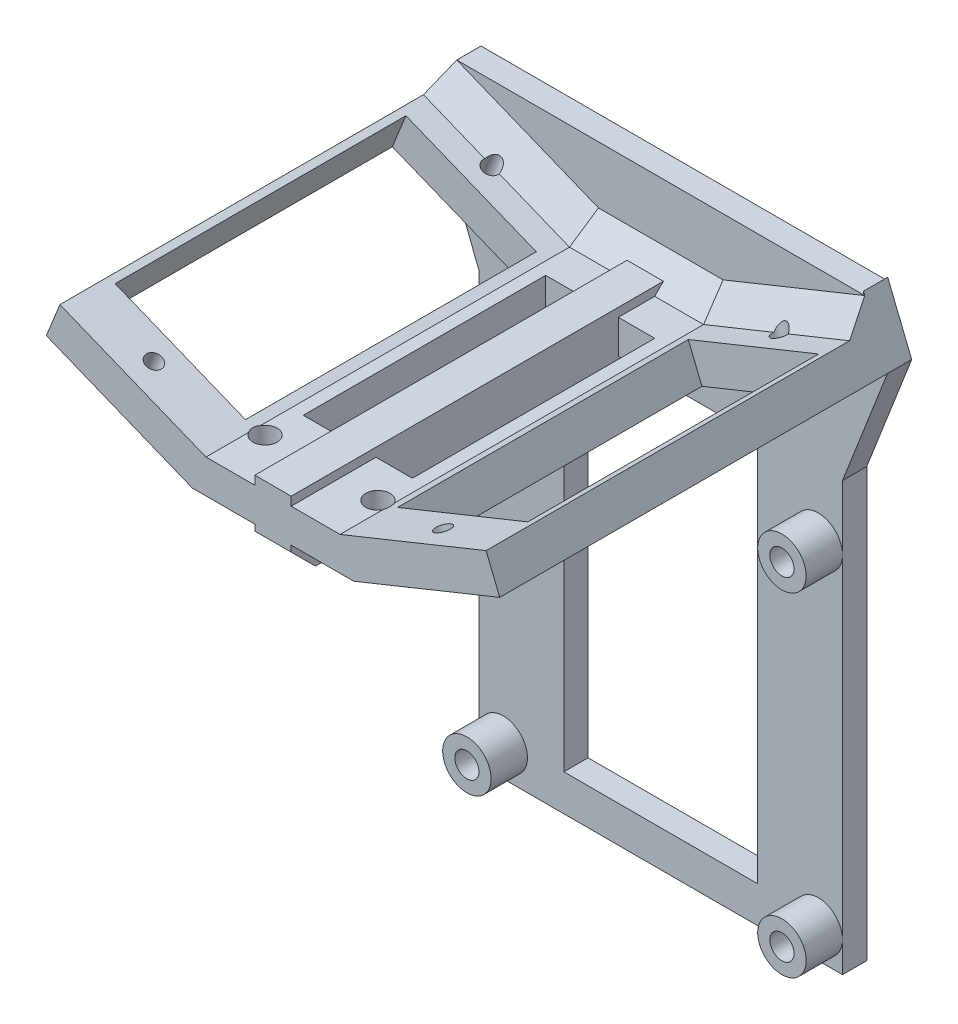
from build123d import *

# Parameters (mm, degrees)
EXTRUDE_1_DEPTH      = 2
EXTRUDE_2_DEPTH      = 32
EXTRUDE_2_DEPTH_BACK = 2
CUT_EXTRUDE_5_REACH  = 59.048
SKETCH_3_R           = 0.65
SKETCH_3_W           = 12.2
SKETCH_3_H           = 24
CUT_EXTRUDE_7_REACH  = 59.919
SKETCH_12_R          = 0.65
SKETCH_12_W          = 12.2
SKETCH_12_H          = 24
CUT_EXTRUDE_8_REACH  = 68.325
SKETCH_13_R          = 1
SKETCH_13_W          = 16
SKETCH_13_H          = 31.950672009
CHAMFER_4_SIZE       = 1
CHAMFER_5_SIZE       = 2
EXTRUDE_START        = -32
SKETCH_14_W          = 3
SKETCH_14_H          = 6
EXTRUDE_8_DEPTH      = 32
CHAMFER_6_SIZE       = 2
EXTRUDE_START_2      = 3
SKETCH_15_R          = 2
SKETCH_15_R_2        = 1
EXTRUDE_9_DEPTH      = 3
CUT_EXTRUDE_9_REACH  = 57.696
SKETCH_16_W          = 3
SKETCH_16_H          = 20
EXTRUDE_10_DEPTH     = 2
EXTRUDE_11_DEPTH     = 28
CUT_EXTRUDE_10_REACH = 55.931
SKETCH_19_R          = 1
CUT_EXTRUDE_11_REACH = 68.325
SKETCH_20_W          = 33.566306147
SKETCH_20_H          = 6.687524296


# Some blends are built 0.0001 mm under size
with BuildPart() as part:
    # 草圖1 → 填料-伸長1 (new body)
    with BuildSketch(Plane.XY):
        Polygon((-15, 0), (15, 0), (15, -1), (18.708735418, -10.179442277), (15, -11.67786865), (15, -55), (-15, -55), (-15, -11.67786865), (-18.708735418, -10.179442277), (-15, -1), align=None)
    extrude(amount=EXTRUDE_1_DEPTH)

    # 草圖2 → 填料-伸長2 (add, two sides: drawn at the far end of the back side and taken through both)
    with BuildSketch(Plane.XY.offset(2).offset(-EXTRUDE_2_DEPTH_BACK)):
        Polygon((-18.708735418, -10.179442277), (-6.655345309, -15.049327991), (6.655345309, -15.049327991), (18.708735418, -10.179442277), (17.584915638, -7.397890713), (5.531525529, -12.267776427), (-5.531525529, -12.267776427), (-17.584915638, -7.397890713), align=None)
    extrude(amount=EXTRUDE_2_DEPTH + EXTRUDE_2_DEPTH_BACK)

    # 草圖3 → 除料-伸長5 (cut, up to next)
    with BuildSketch(Plane(origin=(4.914686172, -15.752599933, 0), x_dir=(0.9271838545667884, 0.37460659341590963, 0), z_dir=(-0.37460659341590963, 0.9271838545667884, 0)), mode=Mode.PRIVATE) as cut_extrude_5_sk1:
        with Locations(Location((8.777361354, -4.1, 0), (0, 0, 180))):
            Circle(SKETCH_3_R)
    cut_extrude_5_tool1 = extrude(cut_extrude_5_sk1.sketch, amount=CUT_EXTRUDE_5_REACH, mode=Mode.PRIVATE) & part.part
    # 草圖3 → 除料-伸長5 (cut, up to next)
    with BuildSketch(Plane(origin=(4.914686172, -15.752599933, 0), x_dir=(0.9271838545667884, 0.37460659341590963, 0), z_dir=(-0.37460659341590963, 0.9271838545667884, 0)), mode=Mode.PRIVATE) as cut_extrude_5_sk2:
        with Locations(Location((8.777361354, -31.9, 0), (0, 0, 180))):
            Circle(SKETCH_3_R)
    cut_extrude_5_tool2 = extrude(cut_extrude_5_sk2.sketch, amount=CUT_EXTRUDE_5_REACH, mode=Mode.PRIVATE) & part.part
    # 草圖3 → 除料-伸長5 (cut, up to next)
    with BuildSketch(Plane(origin=(4.914686172, -15.752599933, 0), x_dir=(0.9271838545667884, 0.37460659341590963, 0), z_dir=(-0.37460659341590963, 0.9271838545667884, 0)), mode=Mode.PRIVATE) as cut_extrude_5_sk3:
        with Locations((8.777361354, -18)):
            Rectangle(SKETCH_3_W, SKETCH_3_H)
    cut_extrude_5_tool3 = extrude(cut_extrude_5_sk3.sketch, amount=CUT_EXTRUDE_5_REACH, mode=Mode.PRIVATE) & part.part
    add(cut_extrude_5_tool1.solids().sort_by_distance((13.052914, -12.464542, 4.1))[0], mode=Mode.SUBTRACT)
    add(cut_extrude_5_tool2.solids().sort_by_distance((13.052914, -12.464542, 31.9))[0], mode=Mode.SUBTRACT)
    add(cut_extrude_5_tool3.solids().sort_by_distance((13.052914, -12.464542, 18))[0], mode=Mode.SUBTRACT)

    # 草圖12 → 除料-伸長7 (cut, up to next)
    with BuildSketch(Plane(origin=(-6.161016101, -15.249049955, 0), x_dir=(0.9271838545667846, -0.3746065934159192, 0), z_dir=(-0.3746065934159192, -0.9271838545667846, 0)), mode=Mode.PRIVATE) as cut_extrude_7_sk1:
        with Locations((-7.433151225, 31.9)):
            Circle(SKETCH_12_R)
    cut_extrude_7_tool1 = extrude(cut_extrude_7_sk1.sketch, amount=-CUT_EXTRUDE_7_REACH, mode=Mode.PRIVATE) & part.part
    # 草圖12 → 除料-伸長7 (cut, up to next)
    with BuildSketch(Plane(origin=(-6.161016101, -15.249049955, 0), x_dir=(0.9271838545667846, -0.3746065934159192, 0), z_dir=(-0.3746065934159192, -0.9271838545667846, 0)), mode=Mode.PRIVATE) as cut_extrude_7_sk2:
        with Locations((-7.433151225, 4.1)):
            Circle(SKETCH_12_R)
    cut_extrude_7_tool2 = extrude(cut_extrude_7_sk2.sketch, amount=-CUT_EXTRUDE_7_REACH, mode=Mode.PRIVATE) & part.part
    # 草圖12 → 除料-伸長7 (cut, up to next)
    with BuildSketch(Plane(origin=(-6.161016101, -15.249049955, 0), x_dir=(0.9271838545667846, -0.3746065934159192, 0), z_dir=(-0.3746065934159192, -0.9271838545667846, 0)), mode=Mode.PRIVATE) as cut_extrude_7_sk3:
        with Locations((-7.433151225, 18)):
            Rectangle(SKETCH_12_W, SKETCH_12_H)
    cut_extrude_7_tool3 = extrude(cut_extrude_7_sk3.sketch, amount=-CUT_EXTRUDE_7_REACH, mode=Mode.PRIVATE) & part.part
    add(cut_extrude_7_tool1.solids().sort_by_distance((-13.052914, -12.464542, 31.9))[0], mode=Mode.SUBTRACT)
    add(cut_extrude_7_tool2.solids().sort_by_distance((-13.052914, -12.464542, 4.1))[0], mode=Mode.SUBTRACT)
    add(cut_extrude_7_tool3.solids().sort_by_distance((-13.052914, -12.464542, 18))[0], mode=Mode.SUBTRACT)

    # 草圖13 → 除料-伸長8 (cut, up to next)
    with BuildSketch(Plane.XY.offset(2), mode=Mode.PRIVATE) as cut_extrude_8_sk1:
        with Locations((-13, -25)):
            Circle(SKETCH_13_R)
    cut_extrude_8_tool1 = extrude(cut_extrude_8_sk1.sketch, amount=-CUT_EXTRUDE_8_REACH, mode=Mode.PRIVATE) & part.part
    # 草圖13 → 除料-伸長8 (cut, up to next)
    with BuildSketch(Plane.XY.offset(2), mode=Mode.PRIVATE) as cut_extrude_8_sk2:
        with Locations((13, -25)):
            Circle(SKETCH_13_R)
    cut_extrude_8_tool2 = extrude(cut_extrude_8_sk2.sketch, amount=-CUT_EXTRUDE_8_REACH, mode=Mode.PRIVATE) & part.part
    # 草圖13 → 除料-伸長8 (cut, up to next)
    with BuildSketch(Plane.XY.offset(2), mode=Mode.PRIVATE) as cut_extrude_8_sk3:
        with Locations((-13, -52.5)):
            Circle(SKETCH_13_R)
    cut_extrude_8_tool3 = extrude(cut_extrude_8_sk3.sketch, amount=-CUT_EXTRUDE_8_REACH, mode=Mode.PRIVATE) & part.part
    # 草圖13 → 除料-伸長8 (cut, up to next)
    with BuildSketch(Plane.XY.offset(2), mode=Mode.PRIVATE) as cut_extrude_8_sk4:
        with Locations((13, -52.5)):
            Circle(SKETCH_13_R)
    cut_extrude_8_tool4 = extrude(cut_extrude_8_sk4.sketch, amount=-CUT_EXTRUDE_8_REACH, mode=Mode.PRIVATE) & part.part
    # 草圖13 → 除料-伸長8 (cut, up to next)
    with BuildSketch(Plane.XY.offset(2), mode=Mode.PRIVATE) as cut_extrude_8_sk5:
        with Locations((0, -36.024663995)):
            Rectangle(SKETCH_13_W, SKETCH_13_H)
    cut_extrude_8_tool5 = extrude(cut_extrude_8_sk5.sketch, amount=-CUT_EXTRUDE_8_REACH, mode=Mode.PRIVATE) & part.part
    add(cut_extrude_8_tool1.solids().sort_by_distance((-13, -25, 2))[0], mode=Mode.SUBTRACT)
    add(cut_extrude_8_tool2.solids().sort_by_distance((13, -25, 2))[0], mode=Mode.SUBTRACT)
    add(cut_extrude_8_tool3.solids().sort_by_distance((-13, -52.5, 2))[0], mode=Mode.SUBTRACT)
    add(cut_extrude_8_tool4.solids().sort_by_distance((13, -52.5, 2))[0], mode=Mode.SUBTRACT)
    add(cut_extrude_8_tool5.solids().sort_by_distance((0, -36.024664, 2))[0], mode=Mode.SUBTRACT)

    # 導角4
    chamfer_4_edges = [part.edges().sort_by_distance(p)[0] for p in [
        (-15, 0, 1),
        (15, 0, 1),
    ]]
    chamfer(chamfer_4_edges, length=CHAMFER_4_SIZE - 0.0001)  # a hair under: the kernel refuses the full size

    # 導角5
    # the kernel refuses this chamfer: 2 mm, written as the material it adds along each edge
    with BuildSketch(Plane(origin=(-0.762679638, -14.194515234, 2), x_dir=(0.374464960998025, 0.9268333020312569, -0.02749587661058639), z_dir=(-0.9271838545667873, 0.37460659341591224, 0))) as chamfer_5_piece_1_section:
        Polygon((CHAMFER_5_SIZE * 0.999621916911, -CHAMFER_5_SIZE * 0.0274958766106), (-CHAMFER_5_SIZE * 0.0274958766106, -CHAMFER_5_SIZE * 0.999621916911), (0, 0), align=None)
    chamfer_5_piece_1 = extrude(amount=18.143365976, mode=Mode.PRIVATE)
    chamfer_5_piece_1 = chamfer_5_piece_1 - Plane(origin=(-11.749090567, -9.237466492, 4.1), x_dir=(0.9271838545667846, -0.3746065934159192, 0), z_dir=(-0.3746065934159192, -0.9271838545667846, 0)) * Cylinder(0.65, 45, mode=Mode.PRIVATE)
    add(chamfer_5_piece_1)
    with BuildSketch(Plane(origin=(10.674891505, -12.267776427, 2), x_dir=(0, 0.9996219169112968, -0.027495876610586355), z_dir=(-1, 0, 0))) as chamfer_5_piece_2:
        Polygon((CHAMFER_5_SIZE * 0.999621916911, -CHAMFER_5_SIZE * 0.0274958766106), (-CHAMFER_5_SIZE * 0.0274958766106, -CHAMFER_5_SIZE * 0.999621916911), (0, 0), align=None)
    extrude(amount=21.349783009)
    with BuildSketch(Plane(origin=(17.584915638, -7.397890713, 2), x_dir=(-0.37446496099802423, 0.926833302031257, -0.027495876610586365), z_dir=(-0.9271838545667876, -0.3746065934159116, 0))) as chamfer_5_piece_3_section:
        Polygon((CHAMFER_5_SIZE * 0.999621916911, -CHAMFER_5_SIZE * 0.0274958766106), (-CHAMFER_5_SIZE * 0.0274958766106, -CHAMFER_5_SIZE * 0.999621916911), (0, 0), align=None)
    chamfer_5_piece_3 = extrude(amount=18.143365976, mode=Mode.PRIVATE)
    chamfer_5_piece_3 = chamfer_5_piece_3 - Plane(origin=(11.664740132, -9.02869184, 4.1), x_dir=(-0.9271838545667884, -0.37460659341590963, 0), z_dir=(0.37460659341590963, -0.9271838545667884, 0)) * Cylinder(0.65, 45, mode=Mode.PRIVATE)
    add(chamfer_5_piece_3)

    # 草圖14 → 填料-伸長8 (add)
    with BuildSketch(Plane.XY.offset(34).offset(EXTRUDE_START)):
        with Locations((0, -14.549327991)):
            Rectangle(SKETCH_14_W, SKETCH_14_H)
    extrude(amount=EXTRUDE_8_DEPTH)

    # 導角6
    chamfer_6_edges = [part.edges().sort_by_distance(p)[0] for p in [
        (0, -17.549327991, 34),
    ]]
    chamfer(chamfer_6_edges, length=CHAMFER_6_SIZE)

    # 草圖15 → 填料-伸長9 (add)
    # profile 1 of 4: a face of its own
    with BuildSketch(Plane.XY.offset(2).offset(EXTRUDE_START_2)):
        with Locations(Location((-13, -25, 0), (0, 0, 180))):
            Circle(SKETCH_15_R)
        with Locations((-13, -25)):
            Circle(SKETCH_15_R_2, mode=Mode.SUBTRACT)
    # profile 2 of 4: a face of its own
    with BuildSketch(Plane.XY.offset(2).offset(EXTRUDE_START_2)):
        with Locations((13, -25)):
            Circle(SKETCH_15_R)
        with Locations((13, -25)):
            Circle(SKETCH_15_R_2, mode=Mode.SUBTRACT)
    # profile 3 of 4: a face of its own
    with BuildSketch(Plane.XY.offset(2).offset(EXTRUDE_START_2)):
        with Locations((13, -52.5)):
            Circle(SKETCH_15_R)
        with Locations((13, -52.5)):
            Circle(SKETCH_15_R_2, mode=Mode.SUBTRACT)
    # profile 4 of 4: a face of its own
    with BuildSketch(Plane.XY.offset(2).offset(EXTRUDE_START_2)):
        with Locations(Location((-13, -52.5, 0), (0, 0, 180))):
            Circle(SKETCH_15_R)
        with Locations((-13, -52.5)):
            Circle(SKETCH_15_R_2, mode=Mode.SUBTRACT)
    extrude(amount=-EXTRUDE_9_DEPTH)

    # 草圖16 → 除料-伸長9 (cut, up to next)
    with BuildSketch(Plane.XZ.offset(15.049327991), mode=Mode.PRIVATE) as cut_extrude_9_sk1:
        with Locations((-3, 17)):
            Rectangle(SKETCH_16_W, SKETCH_16_H)
    cut_extrude_9_tool1 = extrude(cut_extrude_9_sk1.sketch, amount=-CUT_EXTRUDE_9_REACH, mode=Mode.PRIVATE) & part.part
    # 草圖16 → 除料-伸長9 (cut, up to next)
    with BuildSketch(Plane.XZ.offset(15.049327991), mode=Mode.PRIVATE) as cut_extrude_9_sk2:
        with Locations((3, 17)):
            Rectangle(SKETCH_16_W, SKETCH_16_H)
    cut_extrude_9_tool2 = extrude(cut_extrude_9_sk2.sketch, amount=-CUT_EXTRUDE_9_REACH, mode=Mode.PRIVATE) & part.part
    add(cut_extrude_9_tool1.solids().sort_by_distance((-3, -15.049328, 17))[0], mode=Mode.SUBTRACT)
    add(cut_extrude_9_tool2.solids().sort_by_distance((3, -15.049328, 17))[0], mode=Mode.SUBTRACT)

    # 草圖17 → 填料-伸長10 (add)
    with BuildSketch(Plane(origin=(0, 0, 0), x_dir=(-1, 0, 0), z_dir=(0, 0, -1))):
        Polygon((-18.708735418, -10.179442277), (-15, -19.67786865), (-15, -11.67786865), align=None)
        Polygon((18.708735418, -10.179442277), (15, -11.67786865), (15, -19.67786865), align=None)
    extrude(amount=-EXTRUDE_10_DEPTH)

    # 草圖18 → 填料-伸長11 (add)
    with BuildSketch(Plane.XY.offset(34)):
        Polygon((-17.584915638, -7.397890713), (-18.708735418, -10.179442277), (-18.152425106, -10.404206233), (-17.028605325, -7.622654669), align=None)
        Polygon((17.584915638, -7.397890713), (18.708735418, -10.179442277), (18.152425106, -10.404206233), (17.028605325, -7.622654669), align=None)
    extrude(amount=-EXTRUDE_11_DEPTH)

    # 草圖19 → 除料-伸長10 (cut, up to next)
    with BuildSketch(Plane.XZ.offset(17.549327991), mode=Mode.PRIVATE) as cut_extrude_10_sk1:
        with Locations(Location((-4.655345309, 30, 0), (0, 0, 270))):
            Circle(SKETCH_19_R)
    cut_extrude_10_tool1 = extrude(cut_extrude_10_sk1.sketch, amount=-CUT_EXTRUDE_10_REACH, mode=Mode.PRIVATE) & part.part
    # 草圖19 → 除料-伸長10 (cut, up to next)
    with BuildSketch(Plane.XZ.offset(17.549327991), mode=Mode.PRIVATE) as cut_extrude_10_sk2:
        with Locations(Location((4.655345309, 30, 0), (0, 0, 270))):
            Circle(SKETCH_19_R)
    cut_extrude_10_tool2 = extrude(cut_extrude_10_sk2.sketch, amount=-CUT_EXTRUDE_10_REACH, mode=Mode.PRIVATE) & part.part
    add(cut_extrude_10_tool1.solids().sort_by_distance((-4.655345, -17.549328, 30))[0], mode=Mode.SUBTRACT)
    add(cut_extrude_10_tool2.solids().sort_by_distance((4.655345, -17.549328, 30))[0], mode=Mode.SUBTRACT)

    # 草圖20 → 除料-伸長11 (cut, up to next)
    with BuildSketch(Plane.XY.offset(2), mode=Mode.PRIVATE) as cut_extrude_11_sk1:
        with Locations((-0.052549378, -2.199760856)):
            Rectangle(SKETCH_20_W, SKETCH_20_H)
    cut_extrude_11_tool1 = extrude(cut_extrude_11_sk1.sketch, amount=-CUT_EXTRUDE_11_REACH, mode=Mode.PRIVATE) & part.part
    add(cut_extrude_11_tool1.solids().sort_by_distance((-0.052549, -2.199761, 2))[0], mode=Mode.SUBTRACT)


solid = part.part
